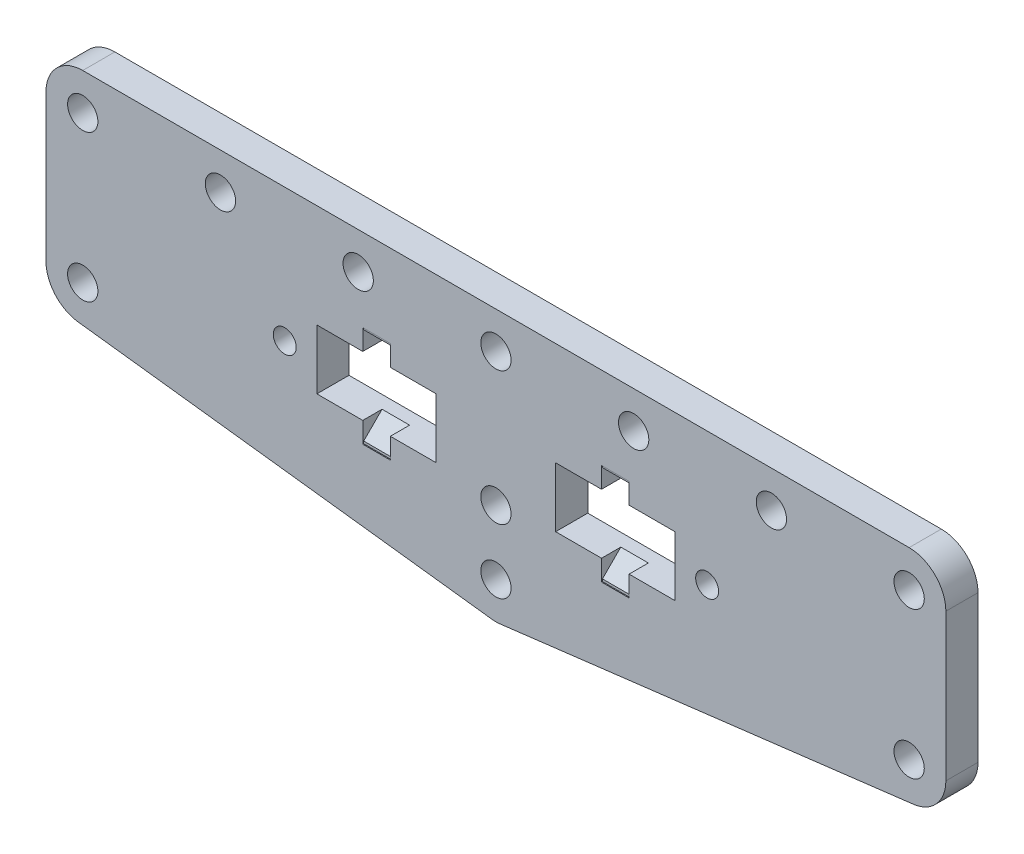
from build123d import *

# Parameters (mm, degrees)
SZKIC1_R                    = 1.65
DODANIE_WYCI_GNI_CIE1_DEPTH = 3.5
SZKIC2_W                    = 13
SZKIC2_H                    = 6.5
WYTNIJ_WYCI_GNI_CIE1_DEPTH  = 4
SZKIC3_R                    = 1.25
WYTNIJ_WYCI_GNI_CIE2_DEPTH  = 4
SZKIC4_R                    = 1.65
WYTNIJ_WYCI_GNI_CIE3_DEPTH  = 4
SZKIC5_W                    = 3
SZKIC5_H                    = 11
WYTNIJ_WYCI_GNI_CIE4_DEPTH  = 0.1
SFAZOWANIE1_SIZE            = 2
SFAZOWANIE2_SIZE            = 2


with BuildPart() as part:
    # Szkic1 → Dodanie-wyciągnięcie1 (new body)
    with BuildSketch(Plane.XY):
        with BuildLine():
            ThreePointArc((-0.48527772, -10.970454072), (0, -11), (0.48527772, -10.970454072))
            Line((0.48527772, -10.970454072), (45.48527772, -5.470454072))
            ThreePointArc((45.48527772, -5.470454072), (47.995088553, -4.151309971), (49, -1.5))
            Line((49, -1.5), (49, 14.5))
            ThreePointArc((49, 14.5), (47.828427125, 17.328427125), (45, 18.5))
            Line((45, 18.5), (-45, 18.5))
            ThreePointArc((-45, 18.5), (-47.828427125, 17.328427125), (-49, 14.5))
            Line((-49, 14.5), (-49, -1.5))
            ThreePointArc((-49, -1.5), (-47.995088553, -4.151309971), (-45.48527772, -5.470454072))
            Line((-45.48527772, -5.470454072), (-0.48527772, -10.970454072))
        make_face()
        with Locations((0, -7)):
            Circle(SZKIC1_R, mode=Mode.SUBTRACT)
        with Locations((-45, -1.5)):
            Circle(SZKIC1_R, mode=Mode.SUBTRACT)
        Circle(SZKIC1_R, mode=Mode.SUBTRACT)
        with Locations((45, -1.5)):
            Circle(SZKIC1_R, mode=Mode.SUBTRACT)
        with Locations((-45, 14.5)):
            Circle(SZKIC1_R, mode=Mode.SUBTRACT)
        with Locations((45, 14.5)):
            Circle(SZKIC1_R, mode=Mode.SUBTRACT)
    extrude(amount=DODANIE_WYCI_GNI_CIE1_DEPTH)

    # Szkic2 → Wytnij-wyciągnięcie1 (cut)
    with BuildSketch(Plane.XY.offset(3.5)):
        with Locations((13, 4)):
            Rectangle(SZKIC2_W, SZKIC2_H)
    wytnij_wyci_gni_cie1 = extrude(amount=-WYTNIJ_WYCI_GNI_CIE1_DEPTH, mode=Mode.SUBTRACT)

    # Szkic3 → Wytnij-wyciągnięcie2 (cut)
    with BuildSketch(Plane.XY.offset(3.5)):
        with Locations((23, 4)):
            Circle(SZKIC3_R)
    wytnij_wyci_gni_cie2 = extrude(amount=-WYTNIJ_WYCI_GNI_CIE2_DEPTH, mode=Mode.SUBTRACT)

    # Lustro1: Wytnij-wyciągnięcie1, Wytnij-wyciągnięcie2 across plane
    add(wytnij_wyci_gni_cie1.mirror(Plane(origin=(0, 0, 0), x_dir=(0, 0, 1), z_dir=(1, 0, 0))), mode=Mode.SUBTRACT)
    add(wytnij_wyci_gni_cie2.mirror(Plane(origin=(0, 0, 0), x_dir=(0, 0, 1), z_dir=(1, 0, 0))), mode=Mode.SUBTRACT)

    # Szkic4 → Wytnij-wyciągnięcie3 (cut)
    with BuildSketch(Plane.XY.offset(3.5)):
        with Locations((0, 14.5)):
            Circle(SZKIC4_R)
        with Locations((15, 14.5)):
            Circle(SZKIC4_R)
        with Locations((30, 14.5)):
            Circle(SZKIC4_R)
    wytnij_wyci_gni_cie3 = extrude(amount=-WYTNIJ_WYCI_GNI_CIE3_DEPTH, mode=Mode.SUBTRACT)

    # Lustro2: Wytnij-wyciągnięcie3 across plane
    add(wytnij_wyci_gni_cie3.mirror(Plane(origin=(0, 0, 0), x_dir=(0, 0, 1), z_dir=(1, 0, 0))), mode=Mode.SUBTRACT)

    # Szkic5 → Wytnij-wyciągnięcie4 (cut)
    with BuildSketch(Plane.XY.offset(3.5)):
        with Locations((13, 4)):
            Rectangle(SZKIC5_W, SZKIC5_H)
    wytnij_wyci_gni_cie4 = extrude(amount=-WYTNIJ_WYCI_GNI_CIE4_DEPTH, mode=Mode.SUBTRACT)

    # Sfazowanie1
    sfazowanie1_edges = [part.edges().sort_by_distance(p)[0] for p in [
        (13, 0.75, 3.4),
        (13, 7.25, 3.4),
    ]]
    chamfer(sfazowanie1_edges, length=SFAZOWANIE1_SIZE)

    # Lustro6: Wytnij-wyciągnięcie4 across plane
    add(wytnij_wyci_gni_cie4.mirror(Plane(origin=(0, 0, 0), x_dir=(0, 0, 1), z_dir=(1, 0, 0))), mode=Mode.SUBTRACT)

    # Sfazowanie2
    sfazowanie2_edges = [part.edges().sort_by_distance(p)[0] for p in [
        (-13, 0.75, 3.4),
        (-13, 7.25, 3.4),
    ]]
    chamfer(sfazowanie2_edges, length=SFAZOWANIE2_SIZE)


solid = part.part
